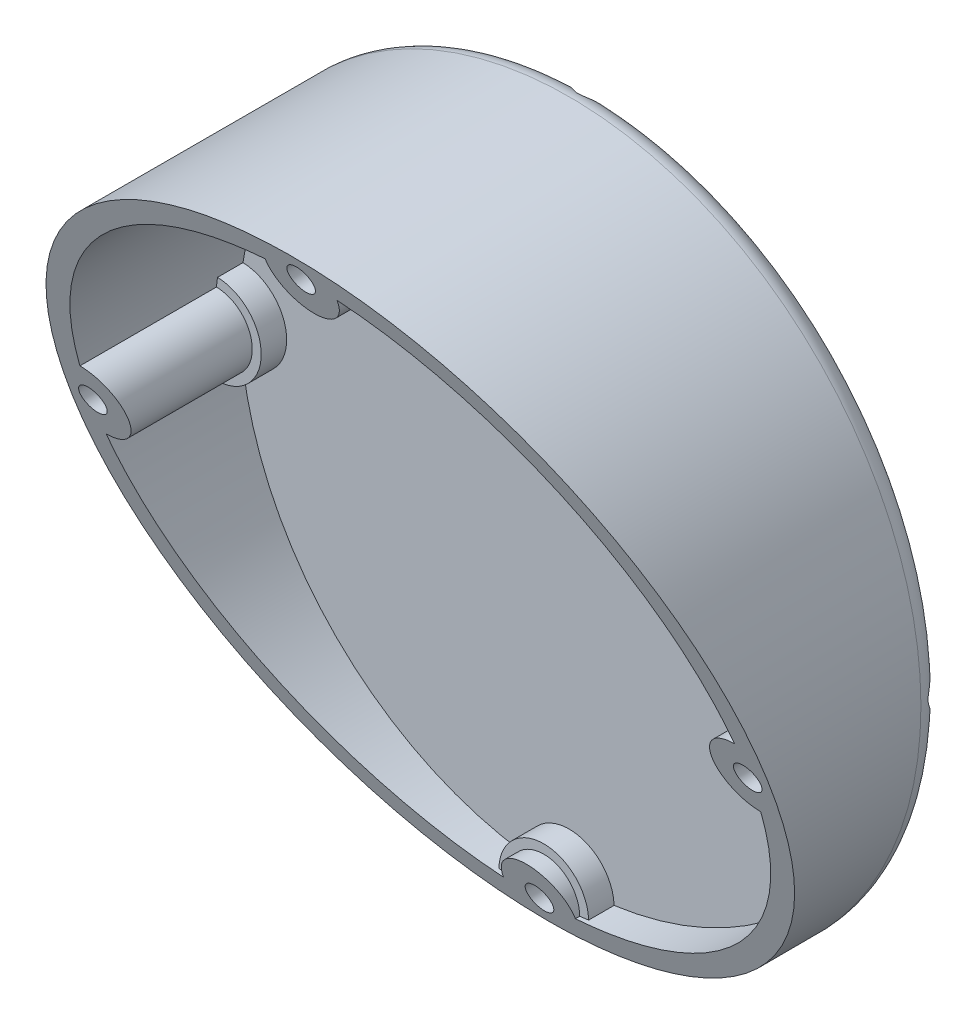
from build123d import *

# Parameters (mm, degrees)
SKETCH_1_R                = 47
EXTRUDE_1_DEPTH           = 40
CUT_EXTRUDE_1_DEPTH       = 78.575769413
CUT_EXTRUDE_1_DEPTH_BACK  = 78.575769413
FILLET_1_R                = 3
HOLE_WIZARD_1_D           = 3.6
HOLE_WIZARD_1_CBORE_D     = 6
HOLE_WIZARD_1_CBORE_DEPTH = 3.4
PATTERN_CIRCULAR_1_COUNT  = 4
SHELL_START               = 3
SHELL_1_DEPTH             = 35.812510714
SHELL_START_2             = 6.4
SHELL_1_2_DEPTH           = 32.412510714


# Read off the part's stored shape, not the designer's step: 抽壳1
with BuildPart() as part:
    # 草图1 → 凸台-拉伸1 (new body)
    with BuildSketch(Plane.XY):
        Circle(SKETCH_1_R)
    extrude(amount=EXTRUDE_1_DEPTH)

    # 草图2 → 切除-拉伸1 (cut, two sides: drawn at the far end of the back side and taken through both)
    with BuildSketch(Plane(origin=(0, 0, 0), x_dir=(0, 0, -1), z_dir=(1, 0, 0)).offset(-CUT_EXTRUDE_1_DEPTH_BACK)):
        Polygon((-40, 47), (-40, -47), (-5.786797979, -47), align=None)
    extrude(amount=CUT_EXTRUDE_1_DEPTH + CUT_EXTRUDE_1_DEPTH_BACK, mode=Mode.SUBTRACT)

    # 圆角1
    fillet_1_edges = [part.edges().sort_by_distance(p)[0] for p in [
        (-47, 0, 0),
    ]]
    fillet(fillet_1_edges, radius=FILLET_1_R)

    # 打孔尺寸(%根据)内六角圆柱头螺钉的类型1 (through all)
    with Locations(Plane(origin=(0, 0, 0), x_dir=(-1, 0, 0), z_dir=(0, 0, -1))):
        with Locations((0, 43.75)):
            hole_wizard_1 = CounterBoreHole(HOLE_WIZARD_1_D / 2, HOLE_WIZARD_1_CBORE_D / 2, HOLE_WIZARD_1_CBORE_DEPTH)

    # 阵列(圆周)1: 打孔尺寸(%根据)内六角圆柱头螺钉的类型1 ×4 about axis
    pattern_circular_1_axis = Axis((0, 0, 0), (0, 0, 1))
    for i in range(1, PATTERN_CIRCULAR_1_COUNT):
        add(hole_wizard_1.rotate(pattern_circular_1_axis, i * 360 / PATTERN_CIRCULAR_1_COUNT), mode=Mode.SUBTRACT)

    # 抽壳1 outline → 抽壳1 (cut)
    with BuildSketch(Plane.XY.offset(SHELL_START)):
        with BuildLine():
            ThreePointArc((-43.589285714, -5.99784719), (-31.112698372, -31.112698372), (-5.99784719, -43.589285714))
            ThreePointArc((-5.99784719, -43.589285714), (0, -37.75), (5.99784719, -43.589285714))
            ThreePointArc((5.99784719, -43.589285714), (31.112698372, -31.112698372), (43.589285714, -5.99784719))
            ThreePointArc((43.589285714, -5.99784719), (37.75, 0), (43.589285714, 5.99784719))
            ThreePointArc((43.589285714, 5.99784719), (31.112698372, 31.112698372), (5.99784719, 43.589285714))
            ThreePointArc((5.99784719, 43.589285714), (0, 37.75), (-5.99784719, 43.589285714))
            ThreePointArc((-5.99784719, 43.589285714), (-31.112698372, 31.112698372), (-43.589285714, 5.99784719))
            ThreePointArc((-43.589285714, 5.99784719), (-37.75, 0), (-43.589285714, -5.99784719))
        make_face()
    extrude(amount=SHELL_1_DEPTH, mode=Mode.SUBTRACT)

    # Shell 1 2 outline → Shell 1 2 (cut)
    with BuildSketch(Plane.XY.offset(SHELL_START_2)):
        with BuildLine():
            ThreePointArc((5.99784719, -43.589285714), (0, -37.75), (-5.99784719, -43.589285714))
            ThreePointArc((-5.99784719, -43.589285714), (-5.399423225, -43.66745045), (-4.799983462, -43.7374))
            ThreePointArc((-4.799983462, -43.7374), (0, -38.95), (4.799983462, -43.7374))
            ThreePointArc((4.799983462, -43.7374), (5.399423225, -43.66745045), (5.99784719, -43.589285714))
        make_face()
        with BuildLine():
            ThreePointArc((-43.7374, -4.799983462), (-43.66745045, -5.399423225), (-43.589285714, -5.99784719))
            ThreePointArc((-43.589285714, -5.99784719), (-37.75, 0), (-43.589285714, 5.99784719))
            ThreePointArc((-43.589285714, 5.99784719), (-43.66745045, 5.399423225), (-43.7374, 4.799983462))
            ThreePointArc((-43.7374, 4.799983462), (-38.95, 0), (-43.7374, -4.799983462))
        make_face()
        with BuildLine():
            ThreePointArc((43.589285714, 5.99784719), (37.75, 0), (43.589285714, -5.99784719))
            ThreePointArc((43.589285714, -5.99784719), (43.66745045, -5.399423225), (43.7374, -4.799983462))
            ThreePointArc((43.7374, -4.799983462), (38.95, 0), (43.7374, 4.799983462))
            ThreePointArc((43.7374, 4.799983462), (43.66745045, 5.399423225), (43.589285714, 5.99784719))
        make_face()
        with BuildLine():
            ThreePointArc((-4.799983462, 43.7374), (-5.399423225, 43.66745045), (-5.99784719, 43.589285714))
            ThreePointArc((-5.99784719, 43.589285714), (0, 37.75), (5.99784719, 43.589285714))
            ThreePointArc((5.99784719, 43.589285714), (5.399423225, 43.66745045), (4.799983462, 43.7374))
            ThreePointArc((4.799983462, 43.7374), (0, 38.95), (-4.799983462, 43.7374))
        make_face()
    extrude(amount=SHELL_1_2_DEPTH, mode=Mode.SUBTRACT)


solid = part.part
